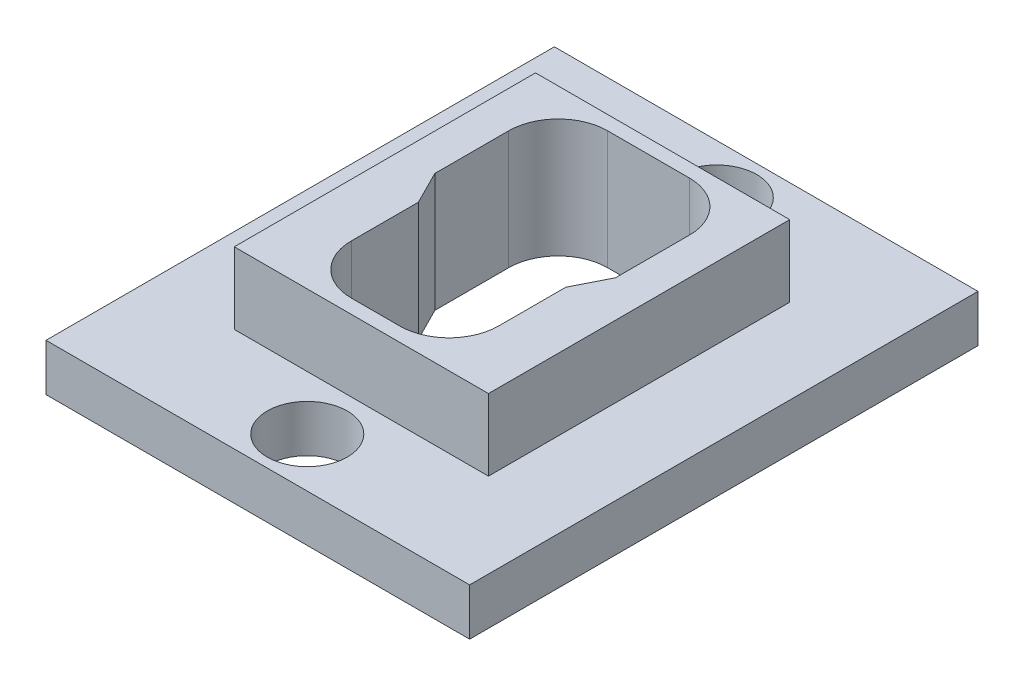
from build123d import *

# Parameters (mm, degrees)
SKETCH1_W               = 22.86
SKETCH1_H               = 27.432
BOSS_EXTRUDE2_DEPTH     = 6.4008
CUT_EXTRUDE2_DEPTH      = 19.966913208
CUT_EXTRUDE2_DEPTH_BACK = 19.966913208
SKETCH4_R               = 2.159
SKETCH5_W               = 22.86
SKETCH5_H               = 27.432
SKETCH5_W_2             = 13.716
SKETCH5_H_2             = 16.256
CUT_EXTRUDE3_DEPTH      = 3.8608
CUT_EXTRUDE4_DEPTH      = 19.966913208
CUT_EXTRUDE4_DEPTH_BACK = 19.966913208


with BuildPart() as part:
    # Sketch1 → Boss-Extrude2 (new body)
    with BuildSketch(Plane(origin=(0, 0, 0), x_dir=(1, 0, 0), z_dir=(0, 1, 0))):
        Rectangle(SKETCH1_W, SKETCH1_H)
        with BuildLine():
            Line((2.208651403, 6.604), (-2.208651403, 6.604))
            ThreePointArc((-2.208651403, 6.604), (-3.555689822, 6.046038418), (-4.113651403, 4.699))
            Line((-4.113651403, 4.699), (-4.113651403, 0.89281026))
            Line((-4.113651403, 0.89281026), (-3.2131, -0.89281026))
            Line((-3.2131, -0.89281026), (-3.2131, -4.699))
            ThreePointArc((-3.2131, -4.699), (-2.655138418, -6.046038418), (-1.3081, -6.604))
            Line((-1.3081, -6.604), (0, -6.604))
            Line((0, -6.604), (1.3081, -6.604))
            ThreePointArc((1.3081, -6.604), (2.655138418, -6.046038418), (3.2131, -4.699))
            Line((3.2131, -4.699), (3.2131, -0.89281026))
            Line((3.2131, -0.89281026), (4.113651403, 0.89281026))
            Line((4.113651403, 0.89281026), (4.113651403, 4.699))
            ThreePointArc((4.113651403, 4.699), (3.555689822, 6.046038418), (2.208651403, 6.604))
        make_face(mode=Mode.SUBTRACT)
    extrude(amount=BOSS_EXTRUDE2_DEPTH)

    # Sketch4 → Cut-Extrude2 (cut, two sides: drawn at the far end of the back side and taken through both)
    with BuildSketch(Plane(origin=(0, 6.4008, 0), x_dir=(1, 0, 0), z_dir=(0, 1, 0)).offset(-CUT_EXTRUDE2_DEPTH_BACK)):
        with Locations((0, 11.049)):
            Circle(SKETCH4_R)
        with Locations((0, -11.049)):
            Circle(SKETCH4_R)
    extrude(amount=CUT_EXTRUDE2_DEPTH + CUT_EXTRUDE2_DEPTH_BACK, mode=Mode.SUBTRACT)

    # Sketch5 → Cut-Extrude3 (cut)
    with BuildSketch(Plane(origin=(0, 6.4008, 0), x_dir=(1, 0, 0), z_dir=(0, 1, 0))):
        Rectangle(SKETCH5_W, SKETCH5_H)
        Rectangle(SKETCH5_W_2, SKETCH5_H_2, mode=Mode.SUBTRACT)
    extrude(amount=-CUT_EXTRUDE3_DEPTH, mode=Mode.SUBTRACT)

    # Sketch6 → Cut-Extrude4 (cut, two sides: drawn at the far end of the back side and taken through both)
    with BuildSketch(Plane(origin=(0, 6.4008, 0), x_dir=(1, 0, 0), z_dir=(0, 1, 0)).offset(-CUT_EXTRUDE4_DEPTH_BACK)):
        with BuildLine():
            Line((-3.9751, -1.074087237), (-3.9751, -4.699))
            ThreePointArc((-3.9751, -4.699), (-3.193953785, -6.584853785), (-1.3081, -7.366))
            Line((-1.3081, -7.366), (1.3081, -7.366))
            ThreePointArc((1.3081, -7.366), (3.193953785, -6.584853785), (3.9751, -4.699))
            Line((3.9751, -4.699), (3.9751, -1.074087237))
            Line((3.9751, -1.074087237), (4.875651403, 0.711533282))
            Line((4.875651403, 0.711533282), (4.875651403, 4.699))
            ThreePointArc((4.875651403, 4.699), (4.094505189, 6.584853785), (2.208651403, 7.366))
            Line((2.208651403, 7.366), (-2.208651403, 7.366))
            ThreePointArc((-2.208651403, 7.366), (-4.094505189, 6.584853785), (-4.875651403, 4.699))
            Line((-4.875651403, 4.699), (-4.875651403, 0.711533282))
            Line((-4.875651403, 0.711533282), (-3.9751, -1.074087237))
        make_face()
    extrude(amount=CUT_EXTRUDE4_DEPTH + CUT_EXTRUDE4_DEPTH_BACK, mode=Mode.SUBTRACT)


solid = part.part
